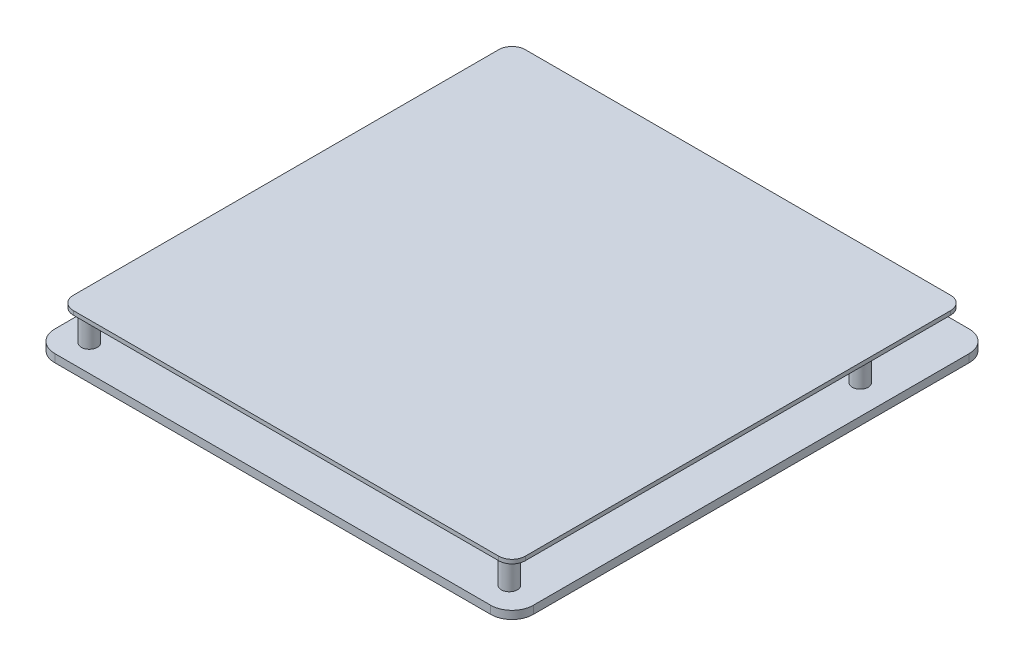
from build123d import *

# Parameters (mm, degrees)
RESSALTO_EXTRUS_O1_DEPTH = 3
ESBO_O2_R                = 3.5
RESSALTO_EXTRUS_O2_DEPTH = 5
ESBO_O3_R                = 3
RESSALTO_EXTRUS_O3_DEPTH = 11
RESSALTO_EXTRUS_O4_DEPTH = 1.5


with BuildPart() as part:
    # Esboço1 → Ressalto-extrusão1 (new body)
    with BuildSketch(Plane(origin=(0, 0, 0), x_dir=(1, 0, 0), z_dir=(0, 1, 0))):
        with BuildLine():
            Line((82, -90), (-82, -90))
            ThreePointArc((-82, -90), (-87.656854249, -87.656854249), (-90, -82))
            Line((-90, -82), (-90, 82))
            ThreePointArc((-90, 82), (-87.656854249, 87.656854249), (-82, 90))
            Line((-82, 90), (82, 90))
            ThreePointArc((82, 90), (87.656854249, 87.656854249), (90, 82))
            Line((90, 82), (90, -82))
            ThreePointArc((90, -82), (87.656854249, -87.656854249), (82, -90))
        make_face()
    extrude(amount=RESSALTO_EXTRUS_O1_DEPTH)

    # Esboço2 → Ressalto-extrusão2 (add)
    with BuildSketch(Plane(origin=(0, 0, 0), x_dir=(-1, 0, 0), z_dir=(0, -1, 0))):
        with Locations((79, -62)):
            Circle(ESBO_O2_R)
        with Locations((-79, -62)):
            Circle(ESBO_O2_R)
        with Locations((-79, 62)):
            Circle(ESBO_O2_R)
        with Locations((79, 62)):
            Circle(ESBO_O2_R)
    extrude(amount=RESSALTO_EXTRUS_O2_DEPTH)

    # Esboço3 → Ressalto-extrusão3 (add)
    with BuildSketch(Plane(origin=(0, 3, 0), x_dir=(1, 0, 0), z_dir=(0, 1, 0))):
        with Locations((-79, -80)):
            Circle(ESBO_O3_R)
        with Locations((-79, 75)):
            Circle(ESBO_O3_R)
        with Locations((79, 52)):
            Circle(ESBO_O3_R)
        with Locations((79, -80)):
            Circle(ESBO_O3_R)
    extrude(amount=RESSALTO_EXTRUS_O3_DEPTH)

    # Esboço4 → Ressalto-extrusão4 (add)
    with BuildSketch(Plane(origin=(0, 14, 0), x_dir=(1, 0, 0), z_dir=(0, 1, 0))):
        with BuildLine():
            Line((-80, 85), (80, 85))
            ThreePointArc((80, 85), (83.535533906, 83.535533906), (85, 80))
            Line((85, 80), (85, -80))
            ThreePointArc((85, -80), (83.535533906, -83.535533906), (80, -85))
            Line((80, -85), (-80, -85))
            ThreePointArc((-80, -85), (-83.535533906, -83.535533906), (-85, -80))
            Line((-85, -80), (-85, 80))
            ThreePointArc((-85, 80), (-83.535533906, 83.535533906), (-80, 85))
        make_face()
    extrude(amount=RESSALTO_EXTRUS_O4_DEPTH)


solid = part.part
